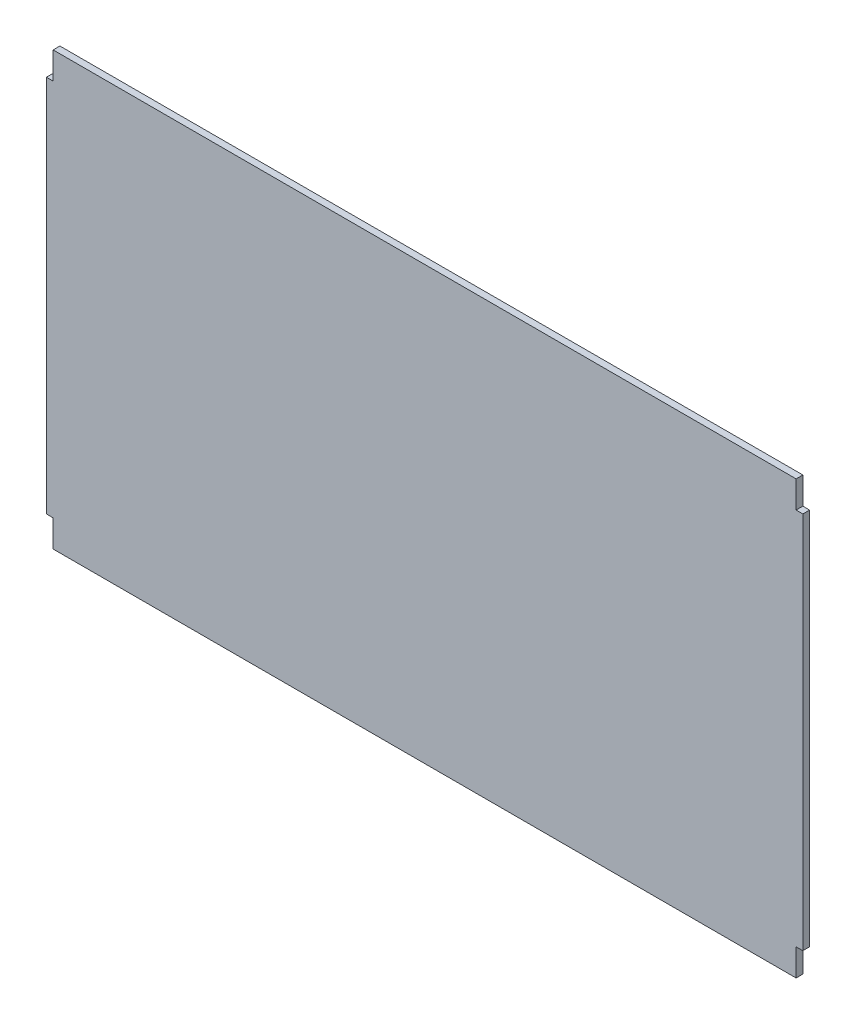
from build123d import *

# Parameters (mm, degrees)
BOSS_EXTRUDE1_DEPTH = 3.175


with BuildPart() as part:
    # Sketch1 → Boss-Extrude1 (new body)
    with BuildSketch(Plane.XY):
        Polygon((3.175, 203.2), (3.175, 190.5), (0, 190.5), (0, 12.7), (3.175, 12.7), (3.175, 0), (352.425, 0), (352.425, 12.7), (355.6, 12.7), (355.6, 190.5), (352.425, 190.5), (352.425, 203.2), align=None)
    extrude(amount=BOSS_EXTRUDE1_DEPTH)


solid = part.part
